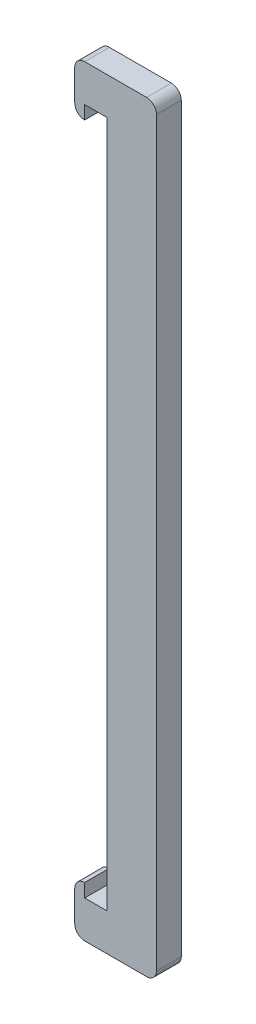
from build123d import *

# Parameters (mm, degrees)
BOSS_EXTRUDE1_DEPTH = 3.175
FILLET1_R           = 2.54


with BuildPart() as part:
    # Sketch1 → Boss-Extrude1 (new, symmetric)
    with BuildSketch(Plane.XY):
        Polygon((-8.240014, 97.536), (-8.240014, 84.582), (-5.700014, 84.582), (-5.700014, 88.011), (0, 88.011), (0, -88.011), (-5.700014, -88.011), (-5.700014, -84.582), (-8.240014, -84.582), (-8.240014, -97.536), (12.7, -97.536), (12.7, 97.536), align=None)
    extrude(amount=BOSS_EXTRUDE1_DEPTH, both=True)

    # Fillet1
    fillet1_edges = [part.edges().sort_by_distance(p)[0] for p in [
        (12.7, -97.536, 0),
        (-8.240014, -97.536, 0),
        (-8.240014, -84.582, 0),
        (12.7, 97.536, 0),
        (-8.240014, 84.582, 0),
        (-8.240014, 97.536, 0),
    ]]
    fillet(fillet1_edges, radius=FILLET1_R - 0.0001)  # a hair under: the kernel refuses the full size


solid = part.part
